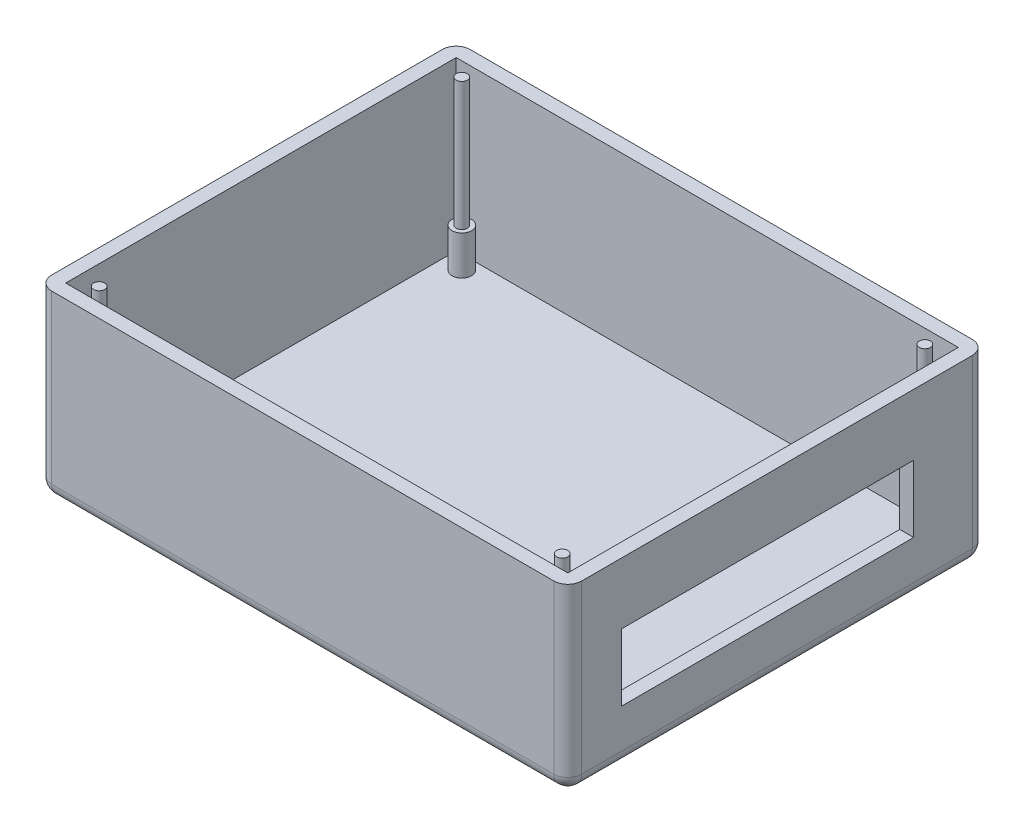
from build123d import *

# Parameters (mm, degrees)
SKETCH1_W           = 95
SKETCH1_H           = 75
BOSS_EXTRUDE1_DEPTH = 32.5
SKETCH2_W           = 90
SKETCH2_H           = 70
CUT_EXTRUDE1_DEPTH  = 30
SKETCH3_R           = 1.75
BOSS_EXTRUDE2_DEPTH = 7
SKETCH4_R           = 1
BOSS_EXTRUDE3_DEPTH = 23
SKETCH5_W           = 52.348164398
SKETCH5_H           = 12
CUT_EXTRUDE2_DEPTH  = 7
FILLET1_R           = 2.5
FILLET2_R           = 2.5
FILLET3_R           = 2.5
FILLET4_R           = 2.5
FILLET5_R           = 2.5


with BuildPart() as part:
    # Sketch1 → Boss-Extrude1 (new body)
    with BuildSketch(Plane(origin=(0, 0, 0), x_dir=(1, 0, 0), z_dir=(0, 1, 0))):
        Rectangle(SKETCH1_W, SKETCH1_H)
    extrude(amount=BOSS_EXTRUDE1_DEPTH)

    # Sketch2 → Cut-Extrude1 (cut)
    with BuildSketch(Plane(origin=(0, 32.5, 0), x_dir=(1, 0, 0), z_dir=(0, 1, 0))):
        Rectangle(SKETCH2_W, SKETCH2_H)
    extrude(amount=-CUT_EXTRUDE1_DEPTH, mode=Mode.SUBTRACT)

    # Sketch3 → Boss-Extrude2 (add)
    with BuildSketch(Plane(origin=(0, 2.5, 0), x_dir=(1, 0, 0), z_dir=(0, 1, 0))):
        with Locations(Location((-41.5, 32.5, 0), (0, 0, 270))):
            Circle(SKETCH3_R)
        with Locations(Location((41.5, 32.5, 0), (0, 0, 270))):
            Circle(SKETCH3_R)
        with Locations(Location((41.5, -32.5, 0), (0, 0, 270))):
            Circle(SKETCH3_R)
        with Locations(Location((-41.5, -32.5, 0), (0, 0, 270))):
            Circle(SKETCH3_R)
    extrude(amount=BOSS_EXTRUDE2_DEPTH)

    # Sketch4 → Boss-Extrude3 (add)
    with BuildSketch(Plane(origin=(0, 9.5, 0), x_dir=(1, 0, 0), z_dir=(0, 1, 0))):
        with Locations(Location((-41.5, 32.5, 0), (0, 0, 270))):
            Circle(SKETCH4_R)
        with Locations(Location((41.5, 32.5, 0), (0, 0, 270))):
            Circle(SKETCH4_R)
        with Locations(Location((41.5, -32.5, 0), (0, 0, 270))):
            Circle(SKETCH4_R)
        with Locations(Location((-41.5, -32.5, 0), (0, 0, 270))):
            Circle(SKETCH4_R)
    extrude(amount=BOSS_EXTRUDE3_DEPTH)

    # Sketch5 → Cut-Extrude2 (cut)
    with BuildSketch(Plane(origin=(47.5, 0, 0), x_dir=(0, 0, -1), z_dir=(1, 0, 0))):
        with Locations((-1.674082199, 15.5)):
            Rectangle(SKETCH5_W, SKETCH5_H)
    extrude(amount=-CUT_EXTRUDE2_DEPTH, mode=Mode.SUBTRACT)

    # Fillet1
    fillet1_edges = [part.edges().sort_by_distance(p)[0] for p in [
        (0, 0, -37.5),
        (47.5, 0, 0),
        (0, 0, 37.5),
        (-47.5, 0, 0),
    ]]
    fillet(fillet1_edges, radius=FILLET1_R)

    # Fillet2
    # the kernel refuses this fillet: 2.5 mm, written as the material it takes off along each edge
    with BuildSketch(Plane(origin=(45, 2.5, 35), x_dir=(0, 0, 1), z_dir=(1, 0, 0))) as fillet2_piece_1_section:
        Polygon((0, 0), (FILLET2_R, 0), (FILLET2_R, FILLET2_R), (0, FILLET2_R), align=None)
    fillet2_piece_1 = extrude(amount=FILLET2_R, mode=Mode.PRIVATE)
    fillet2_piece_1 = fillet2_piece_1 - Plane(origin=(45, 2.5, 35), x_dir=(0, 0.7071067811865475, -0.7071067811865475), z_dir=(1, 0, 0)) * Sphere(FILLET2_R, mode=Mode.PRIVATE)
    add(fillet2_piece_1, mode=Mode.SUBTRACT)
    with BuildSketch(Plane(origin=(47.5, 2.5, 37.5), x_dir=(0, 0, -1), z_dir=(0, 1, 0))) as fillet2_piece_2:
        with BuildLine():
            CenterArc((FILLET2_R, FILLET2_R), FILLET2_R, 180, 90)
            Line((0, FILLET2_R), (0, 0))
            Line((0, 0), (FILLET2_R, 0))
        make_face()
    extrude(amount=36.25, mode=Mode.SUBTRACT)

    # Fillet3
    # the kernel refuses this fillet: 2.5 mm, written as the material it takes off along each edge
    with BuildSketch(Plane(origin=(45, 2.5, -35), x_dir=(1, 0, 0), z_dir=(0, 0, -1))) as fillet3_piece_1_section:
        Polygon((0, 0), (FILLET3_R, 0), (FILLET3_R, FILLET3_R), (0, FILLET3_R), align=None)
    fillet3_piece_1 = extrude(amount=FILLET3_R, mode=Mode.PRIVATE)
    fillet3_piece_1 = fillet3_piece_1 - Plane(origin=(45, 2.5, -35), x_dir=(-0.7071067811865475, 0.7071067811865475, 0), z_dir=(0, 0, -1)) * Sphere(FILLET3_R, mode=Mode.PRIVATE)
    add(fillet3_piece_1, mode=Mode.SUBTRACT)
    with BuildSketch(Plane(origin=(47.5, 2.5, -37.5), x_dir=(-1, 0, 0), z_dir=(0, 1, 0))) as fillet3_piece_2:
        with BuildLine():
            CenterArc((FILLET3_R, FILLET3_R), FILLET3_R, 180, 90)
            Line((0, FILLET3_R), (0, 0))
            Line((0, 0), (FILLET3_R, 0))
        make_face()
    extrude(amount=36.25, mode=Mode.SUBTRACT)

    # Fillet4
    # the kernel refuses this fillet: 2.5 mm, written as the material it takes off along each edge
    with BuildSketch(Plane(origin=(-45, 2.5, -35), x_dir=(-1, 0, 0), z_dir=(0, 0, -1))) as fillet4_piece_1_section:
        Polygon((0, 0), (FILLET4_R, 0), (FILLET4_R, -FILLET4_R), (0, -FILLET4_R), align=None)
    fillet4_piece_1 = extrude(amount=FILLET4_R, mode=Mode.PRIVATE)
    fillet4_piece_1 = fillet4_piece_1 - Plane(origin=(-45, 2.5, -35), x_dir=(0.7071067811865475, 0.7071067811865475, 0), z_dir=(0, 0, -1)) * Sphere(FILLET4_R, mode=Mode.PRIVATE)
    add(fillet4_piece_1, mode=Mode.SUBTRACT)
    with BuildSketch(Plane(origin=(-47.5, 2.5, -37.5), x_dir=(1, 0, 0), z_dir=(0, 1, 0))) as fillet4_piece_2:
        with BuildLine():
            CenterArc((FILLET4_R, -FILLET4_R), FILLET4_R, 90, 90)
            Line((0, -FILLET4_R), (0, 0))
            Line((0, 0), (FILLET4_R, 0))
        make_face()
    extrude(amount=36.25, mode=Mode.SUBTRACT)

    # Fillet5
    # the kernel refuses this fillet: 2.5 mm, written as the material it takes off along each edge
    with BuildSketch(Plane(origin=(-45, 2.5, 35), x_dir=(0, 0, 1), z_dir=(-1, 0, 0))) as fillet5_piece_1_section:
        Polygon((0, 0), (FILLET5_R, 0), (FILLET5_R, -FILLET5_R), (0, -FILLET5_R), align=None)
    fillet5_piece_1 = extrude(amount=FILLET5_R, mode=Mode.PRIVATE)
    fillet5_piece_1 = fillet5_piece_1 - Plane(origin=(-45, 2.5, 35), x_dir=(0, 0.7071067811865475, -0.7071067811865475), z_dir=(-1, 0, 0)) * Sphere(FILLET5_R, mode=Mode.PRIVATE)
    add(fillet5_piece_1, mode=Mode.SUBTRACT)
    with BuildSketch(Plane(origin=(-47.5, 2.5, 37.5), x_dir=(0, 0, -1), z_dir=(0, 1, 0))) as fillet5_piece_2:
        with BuildLine():
            CenterArc((FILLET5_R, -FILLET5_R), FILLET5_R, 90, 90)
            Line((0, -FILLET5_R), (0, 0))
            Line((0, 0), (FILLET5_R, 0))
        make_face()
    extrude(amount=36.25, mode=Mode.SUBTRACT)


solid = part.part
